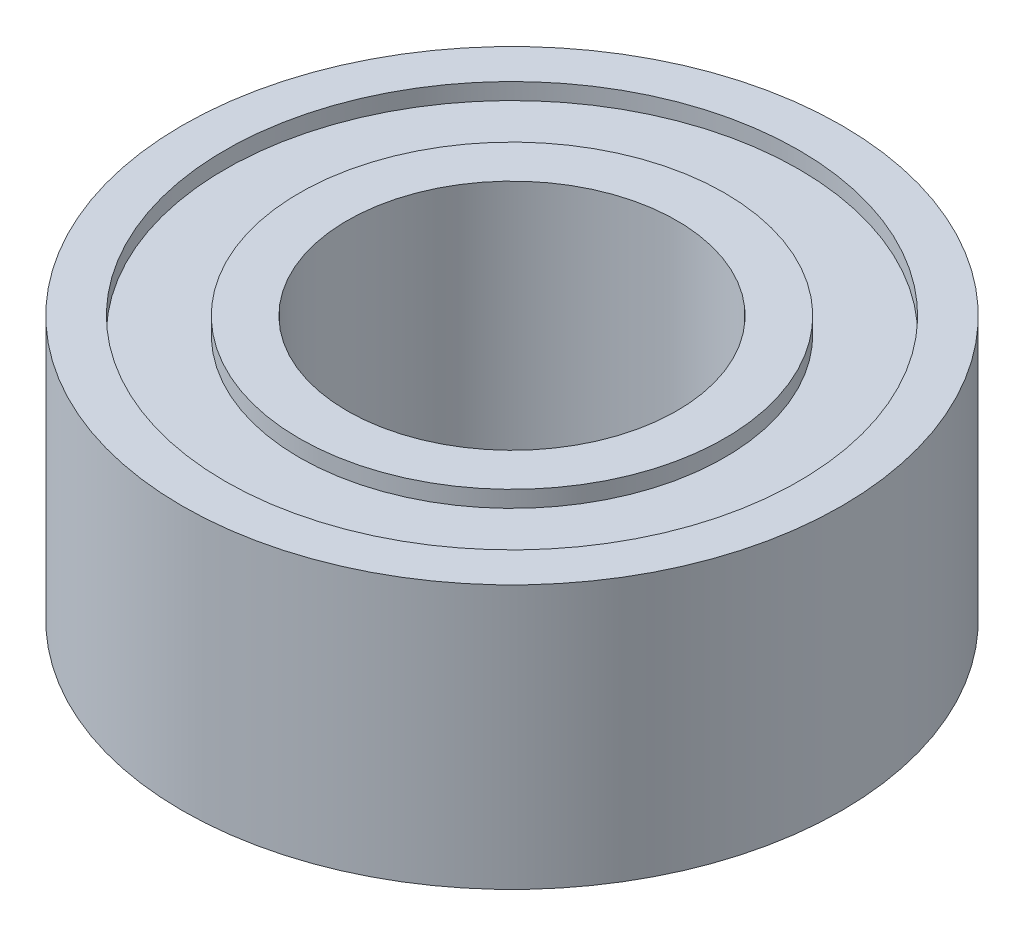
from build123d import *

# Parameters (mm, degrees)
SKETCH1_R           = 5
SKETCH1_R_2         = 2.5
BOSS_EXTRUDE1_DEPTH = 4
SKETCH2_R           = 4.35
SKETCH2_R_2         = 3.225
CUT_EXTRUDE1_DEPTH  = 0.25
CUT_EXTRUDE2_START  = -0.25
SKETCH3_R           = 4.35
SKETCH3_R_2         = 3.225
CUT_EXTRUDE2_DEPTH  = 0.25


with BuildPart() as part:
    # Sketch1 → Boss-Extrude1 (new body)
    with BuildSketch(Plane(origin=(0, 0, 0), x_dir=(1, 0, 0), z_dir=(0, 1, 0))):
        Circle(SKETCH1_R)
        Circle(SKETCH1_R_2, mode=Mode.SUBTRACT)
    extrude(amount=BOSS_EXTRUDE1_DEPTH)

    # Sketch2 → Cut-Extrude1 (cut)
    with BuildSketch(Plane(origin=(0, 4, 0), x_dir=(1, 0, 0), z_dir=(0, 1, 0))):
        Circle(SKETCH2_R)
        Circle(SKETCH2_R_2, mode=Mode.SUBTRACT)
    extrude(amount=-CUT_EXTRUDE1_DEPTH, mode=Mode.SUBTRACT)

    # Sketch3 → Cut-Extrude2 (cut)
    with BuildSketch(Plane.XZ.offset(CUT_EXTRUDE2_START)):
        Circle(SKETCH3_R)
        Circle(SKETCH3_R_2, mode=Mode.SUBTRACT)
    extrude(amount=CUT_EXTRUDE2_DEPTH, mode=Mode.SUBTRACT)


solid = part.part
